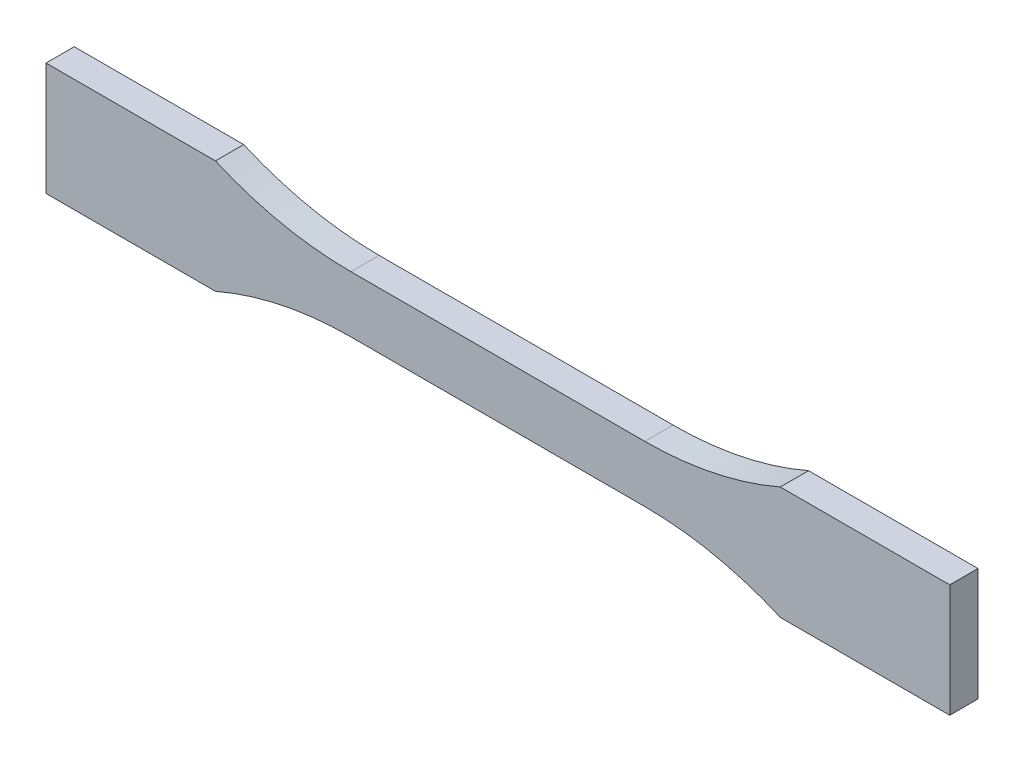
from build123d import *

# Parameters (mm, degrees)
F_1_4_INCH_THICKNESS_DEPTH = 3.175
FILLET1_R                  = 76.2


with BuildPart() as part:
    # Sketch1 → 1/4 Inch Thickness (new, symmetric)
    with BuildSketch(Plane.XY):
        Polygon((-63.5, 6.35), (63.5, 6.35), (63.5, 12.7), (101.6, 12.7), (101.6, -12.7), (63.5, -12.7), (63.5, -6.35), (-63.5, -6.35), (-63.5, -12.7), (-101.6, -12.7), (-101.6, 12.7), (-63.5, 12.7), align=None)
    extrude(amount=F_1_4_INCH_THICKNESS_DEPTH, both=True)

    # Fillet1
    # the kernel refuses this fillet: 76.2 mm, written as the material it adds along each edge
    with BuildSketch(Plane(origin=(63.5, -6.35, 3.175), x_dir=(-1, 0, 0), z_dir=(0, 0, -1))) as fillet1_piece_1:
        with BuildLine():
            CenterArc((30.453530173, -76.2), FILLET1_R, 90, 23.556464309)
            Line((0, -6.35), (-0.609070603, -4.953))
            ThreePointArc((-0.609070603, -4.953), (-1.524, -3.175), (-1.524, 0))
            Line((-1.524, 0), (0, 1.524))
            Line((0, 1.524), (30.453530173, 1.524))
            Line((30.453530173, 1.524), (30.453530173, 0))
        make_face()
    extrude(amount=6.35)
    with BuildSketch(Plane(origin=(63.5, 6.35, 3.175), x_dir=(-1, 0, 0), z_dir=(0, 0, -1)), Plane(origin=(-63.5, 6.35, -3.175), x_dir=(1, 0, 0), z_dir=(0, 0, 1))) as fillet1_piece_2:
        with BuildLine():
            CenterArc((30.453530173, 76.2), FILLET1_R, 246.443535691, 23.556464309)
            Line((0, 6.35), (-0.609070603, 4.953))
            ThreePointArc((-0.609070603, 4.953), (-1.524, 3.175), (-1.524, 0))
            Line((-1.524, 0), (0, -1.524))
            Line((0, -1.524), (30.453530173, -1.524))
            Line((30.453530173, -1.524), (30.453530173, 0))
        make_face()
    extrude(amount=6.35)
    with BuildSketch(Plane(origin=(-63.5, -6.35, 3.175), x_dir=(0, -1, 0), z_dir=(0, 0, -1))) as fillet1_piece_3:
        with BuildLine():
            CenterArc((76.2, -30.453530173), FILLET1_R, 156.443535691, 23.556464309)
            Line((0, -30.453530173), (-1.524, -30.453530173))
            Line((-1.524, -30.453530173), (-1.524, 0))
            Line((-1.524, 0), (0, 1.524))
            ThreePointArc((0, 1.524), (3.175, 1.524), (4.953, 0.609070603))
            Line((4.953, 0.609070603), (6.35, 0))
        make_face()
    extrude(amount=6.35)


solid = part.part
